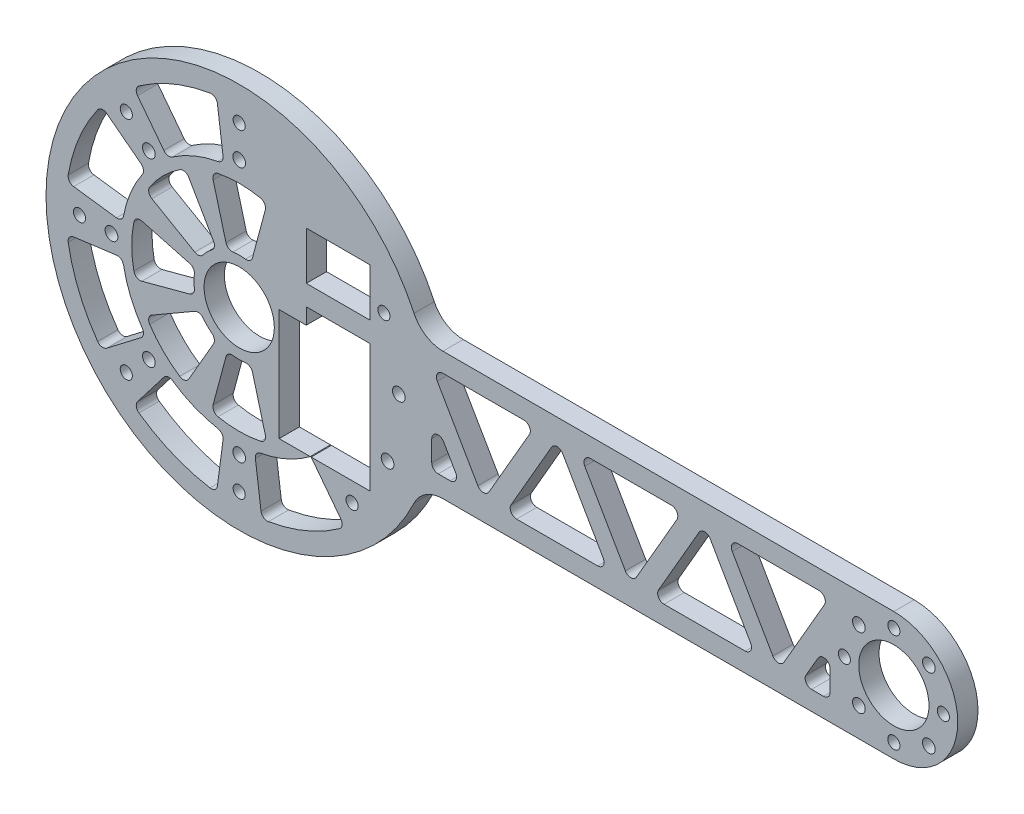
from build123d import *
from OCP.BRepFilletAPI import BRepFilletAPI_MakeChamfer

# Parameters (mm, degrees)
SKETCH1_R                = 11
SKETCH1_R_2              = 1.89865
SKETCH1_R_3              = 1.9939
BOSS_EXTRUDE1_DEPTH      = 6.35
FILLET1_R                = 10
CUT_EXTRUDE1_DEPTH       = 234.078468547
FILLET2_R                = 2
SKETCH3_W                = 20
SKETCH3_H                = 15
CUT_EXTRUDE2_DEPTH       = 234.078468547
CUT_EXTRUDE3_DEPTH       = 234.078468547
FILLET4_R                = 2
CIRPATTERN2_COUNT        = 8
FILLET4_OF_CIRPATTERN2_R = 2
CUT_EXTRUDE4_DEPTH       = 234.078468547
FILLET5_R                = 2
CIRPATTERN3_DEPTH        = 6.35
CHAMFER3_SIZE            = 2.301024407
CHAMFER3_SIZE2           = 2.00025


# Read off the part's stored shape, not the designer's step: CirPattern3
with BuildPart() as part:
    # Sketch1 → Boss-Extrude1 (new body)
    with BuildSketch(Plane.XY):
        with BuildLine():
            Line((57.098598932, -20), (205, -20))
            ThreePointArc((205, -20), (225, 0), (205, 20))
            Line((205, 20), (57.098598932, 20))
            ThreePointArc((57.098598932, 20), (-60.5, 0), (57.098598932, -20))
        make_face()
        Circle(SKETCH1_R, mode=Mode.SUBTRACT)
        with Locations((45.315389352, 21.130913087)):
            Circle(SKETCH1_R_2, mode=Mode.SUBTRACT)
        with Locations((46.467376211, -18.460307366)):
            Circle(SKETCH1_R_3, mode=Mode.SUBTRACT)
        with Locations((205, 0)):
            Circle(SKETCH1_R, mode=Mode.SUBTRACT)
        with Locations((49.978847504, 1.454235937)):
            Circle(SKETCH1_R_3, mode=Mode.SUBTRACT)
        with Locations((205, -15.5)):
            Circle(SKETCH1_R_2, mode=Mode.SUBTRACT)
        with Locations((215.960155108, -10.960155108)):
            Circle(SKETCH1_R_3, mode=Mode.SUBTRACT)
        with Locations((189.5, 0)):
            Circle(SKETCH1_R_2, mode=Mode.SUBTRACT)
        with Locations((194.039844892, -10.960155108)):
            Circle(SKETCH1_R_3, mode=Mode.SUBTRACT)
        with Locations((205, 15.5)):
            Circle(SKETCH1_R_2, mode=Mode.SUBTRACT)
        with Locations((194.039844892, 10.960155108)):
            Circle(SKETCH1_R_3, mode=Mode.SUBTRACT)
        with Locations((220.5, 0)):
            Circle(SKETCH1_R_2, mode=Mode.SUBTRACT)
        with Locations((215.960155108, 10.960155108)):
            Circle(SKETCH1_R_3, mode=Mode.SUBTRACT)
        with Locations((0, -40)):
            Circle(SKETCH1_R_3, mode=Mode.SUBTRACT)
        with Locations((0, -50)):
            Circle(SKETCH1_R_2, mode=Mode.SUBTRACT)
        with Locations((-28.284271247, -28.284271247)):
            Circle(SKETCH1_R_3, mode=Mode.SUBTRACT)
        with Locations((-35.355339059, -35.355339059)):
            Circle(SKETCH1_R_2, mode=Mode.SUBTRACT)
        with Locations((-40, 0)):
            Circle(SKETCH1_R_3, mode=Mode.SUBTRACT)
        with Locations((-50, 0)):
            Circle(SKETCH1_R_2, mode=Mode.SUBTRACT)
        with Locations((-28.284271247, 28.284271247)):
            Circle(SKETCH1_R_3, mode=Mode.SUBTRACT)
        with Locations((-35.355339059, 35.355339059)):
            Circle(SKETCH1_R_2, mode=Mode.SUBTRACT)
        with Locations((0, 40)):
            Circle(SKETCH1_R_3, mode=Mode.SUBTRACT)
        with Locations((0, 50)):
            Circle(SKETCH1_R_2, mode=Mode.SUBTRACT)
        with Locations((35.355339059, -35.355339059)):
            Circle(SKETCH1_R_2, mode=Mode.SUBTRACT)
    extrude(amount=BOSS_EXTRUDE1_DEPTH)

    # Fillet1
    fillet1_edges = [part.edges().sort_by_distance(p)[0] for p in [
        (57.098598932, 20, 3.175),
        (57.098598932, -20, 3.175),
    ]]
    fillet(fillet1_edges, radius=FILLET1_R)

    # Sketch2 → Cut-Extrude1 (cut, through all)
    with BuildSketch(Plane.XY.offset(6.35)):
        Polygon((60.292341855, 14), (92.62395693, 14), (76.458149392, -14), align=None)
        Polygon((83.386352623, -14), (99.55216016, 14), (115.717967697, -14), align=None)
        Polygon((106.48036339, 14), (122.646170928, -14), (138.811978465, 14), align=None)
        Polygon((129.574374158, -14), (145.740181695, 14), (161.905989232, -14), align=None)
        Polygon((152.668384925, 14), (168.834192463, -14), (185, 14), align=None)
        Polygon((60.292341855, 2), (60.292341855, -14), (69.529946162, -14), align=None)
        Polygon((185, 2), (185, -14), (175.762395693, -14), align=None)
    extrude(amount=-CUT_EXTRUDE1_DEPTH, mode=Mode.SUBTRACT)

    # Fillet2
    fillet2_edges = [part.edges().sort_by_distance(p)[0] for p in [
        (76.458149392, -14, 3.175),
        (60.292341855, 14, 3.175),
        (92.62395693, 14, 3.175),
        (115.717967697, -14, 3.175),
        (83.386352623, -14, 3.175),
        (99.55216016, 14, 3.175),
        (106.48036339, 14, 3.175),
        (138.811978465, 14, 3.175),
        (122.646170928, -14, 3.175),
        (161.905989232, -14, 3.175),
        (129.574374158, -14, 3.175),
        (145.740181695, 14, 3.175),
        (152.668384925, 14, 3.175),
        (185, 14, 3.175),
        (168.834192463, -14, 3.175),
        (60.292341855, 2, 3.175),
        (69.529946162, -14, 3.175),
        (60.292341855, -14, 3.175),
        (175.762395693, -14, 3.175),
        (185, 2, 3.175),
        (185, -14, 3.175),
    ]]
    fillet(fillet2_edges, radius=FILLET2_R)

    # Sketch3 → Cut-Extrude2 (cut, through all)
    with BuildSketch(Plane.XY):
        Polygon((12.5, -29.35), (41, -29.35), (41, 10.65), (21, 10.65), (21, 5.65), (12.5, 5.65), align=None)
        with Locations((31, 24.5)):
            Rectangle(SKETCH3_W, SKETCH3_H)
    extrude(amount=CUT_EXTRUDE2_DEPTH, mode=Mode.SUBTRACT)

    # Sketch4 → Cut-Extrude3 (cut, through all)
    with BuildSketch(Plane.XY.offset(6.35)):
        with BuildLine():
            Line((-13.691998588, 3.668759964), (-32.503404055, 8.709260868))
            ThreePointArc((-32.503404055, 8.709260868), (-33.65, 0), (-32.503404055, -8.709260868))
            Line((-32.503404055, -8.709260868), (-13.691998588, -3.668759964))
            ThreePointArc((-13.691998588, -3.668759964), (-14.175, 0), (-13.691998588, 3.668759964))
        make_face()
    cut_extrude3 = extrude(amount=-CUT_EXTRUDE3_DEPTH, mode=Mode.SUBTRACT)

    # Fillet4
    fillet4_edges = [part.edges().sort_by_distance(p)[0] for p in [
        (-13.691998588, 3.668759964, 3.175),
        (-13.691998588, -3.668759964, 3.175),
        (-32.503404055, -8.709260868, 3.175),
        (-32.503404055, 8.709260868, 3.175),
    ]]
    fillet(fillet4_edges, radius=FILLET4_R)

    # CirPattern2: Cut-Extrude3 ×8 about axis, 3 skipped
    cirpattern2_axis = Axis((0, 0, 0), (0, 0, -1))
    add([cut_extrude3.rotate(cirpattern2_axis, i * 360 / CIRPATTERN2_COUNT) for i in range(1, CIRPATTERN2_COUNT) if i not in (3, 4, 5)], mode=Mode.SUBTRACT)

    # Fillet4 of CirPattern2
    fillet4_of_cirpattern2_edges = [part.edges().sort_by_distance(p)[0] for p in [
        (-7.0875, 12.275910099, 3.175),
        (-12.275910099, 7.0875, 3.175),
        (-29.141754837, 16.825, 3.175),
        (-16.825, 29.141754837, 3.175),
        (3.668759964, 13.691998588, 3.175),
        (-3.668759964, 13.691998588, 3.175),
        (-8.709260868, 32.503404055, 3.175),
        (8.709260868, 32.503404055, 3.175),
        (-3.668759964, -13.691998588, 3.175),
        (3.668759964, -13.691998588, 3.175),
        (8.709260868, -32.503404055, 3.175),
        (-8.709260868, -32.503404055, 3.175),
        (-12.275910099, -7.0875, 3.175),
        (-7.0875, -12.275910099, 3.175),
        (-16.825, -29.141754837, 3.175),
        (-29.141754837, -16.825, 3.175),
    ]]
    fillet(fillet4_of_cirpattern2_edges, radius=FILLET4_OF_CIRPATTERN2_R)

    # Sketch5 → Cut-Extrude4 (cut, through all)
    with BuildSketch(Plane.XY.offset(6.35)):
        with BuildLine():
            Line((-43.098920211, 33.070964631), (-29.215236756, 22.417639623))
            ThreePointArc((-29.215236756, 22.417639623), (-34.021863785, 14.092317397), (-36.50995702, 4.806627029))
            Line((-36.50995702, 4.806627029), (-53.860242094, 7.090835392))
            ThreePointArc((-53.860242094, 7.090835392), (-50.189755604, 20.789277463), (-43.098920211, 33.070964631))
        make_face()
    extrude(amount=-CUT_EXTRUDE4_DEPTH, mode=Mode.SUBTRACT)

    # Fillet5
    fillet5_edges = [part.edges().sort_by_distance(p)[0] for p in [
        (-29.215236756, 22.417639623, 3.175),
        (-36.50995702, 4.806627029, 3.175),
        (-53.860242094, 7.090835392, 3.175),
        (-43.098920211, 33.070964631, 3.175),
    ]]
    fillet(fillet5_edges, radius=FILLET5_R)

    # CirPattern3 outline → CirPattern3 (cut)
    with BuildSketch(Plane.XY):
        with BuildLine():
            ThreePointArc((-20.882905689, 30.331252447), (-14.092317397, 34.021863785), (-6.680990063, 36.213878511))
            ThreePointArc((-6.680990063, 36.213878511), (-5.426291253, 37.004451007), (-5.060951125, 38.441740319))
            Line((-5.060951125, 38.441740319), (-6.824792128, 51.839442873))
            ThreePointArc((-6.824792128, 51.839442873), (-7.620711046, 53.188079996), (-9.144334764, 53.549853097))
            ThreePointArc((-9.144334764, 53.549853097), (-20.789277463, 50.189755604), (-31.399443135, 44.331485378))
            ThreePointArc((-31.399443135, 44.331485378), (-32.220995585, 42.998308501), (-31.830164795, 41.481878382))
            Line((-31.830164795, 41.481878382), (-23.6037824, 30.761048119))
            ThreePointArc((-23.6037824, 30.761048119), (-22.329130899, 30.003065582), (-20.882905689, 30.331252447))
        make_face()
        with BuildLine():
            ThreePointArc((22.240911065, -29.35), (14.862614113, -33.692481754), (6.680990063, -36.213878511))
            ThreePointArc((6.680990063, -36.213878511), (5.426291253, -37.004451007), (5.060951125, -38.441740319))
            Line((5.060951125, -38.441740319), (6.824792128, -51.839442873))
            ThreePointArc((6.824792128, -51.839442873), (7.620711046, -53.188079996), (9.144334764, -53.549853097))
            ThreePointArc((9.144334764, -53.549853097), (20.789277463, -50.189755604), (31.399443135, -44.331485378))
            ThreePointArc((31.399443135, -44.331485378), (32.220995585, -42.998308501), (31.830164795, -41.481878382))
            Line((31.830164795, -41.481878382), (22.521047097, -29.35))
            Line((22.521047097, -29.35), (22.240911065, -29.35))
        make_face()
        with BuildLine():
            ThreePointArc((-6.680990063, -36.213878511), (-14.092317397, -34.021863785), (-20.882905689, -30.331252447))
            ThreePointArc((-20.882905689, -30.331252447), (-22.329130899, -30.003065582), (-23.6037824, -30.761048119))
            Line((-23.6037824, -30.761048119), (-31.830164795, -41.481878382))
            ThreePointArc((-31.830164795, -41.481878382), (-32.220995585, -42.998308501), (-31.399443135, -44.331485378))
            ThreePointArc((-31.399443135, -44.331485378), (-20.789277463, -50.189755604), (-9.144334764, -53.549853097))
            ThreePointArc((-9.144334764, -53.549853097), (-7.620711046, -53.188079996), (-6.824792128, -51.839442873))
            Line((-6.824792128, -51.839442873), (-5.060951125, -38.441740319))
            ThreePointArc((-5.060951125, -38.441740319), (-5.426291253, -37.004451007), (-6.680990063, -36.213878511))
        make_face()
        with BuildLine():
            ThreePointArc((-30.331252447, -20.882905689), (-34.021863785, -14.092317397), (-36.213878511, -6.680990063))
            ThreePointArc((-36.213878511, -6.680990063), (-37.004451007, -5.426291253), (-38.441740319, -5.060951125))
            Line((-38.441740319, -5.060951125), (-51.839442873, -6.824792128))
            ThreePointArc((-51.839442873, -6.824792128), (-53.188079996, -7.620711046), (-53.549853097, -9.144334764))
            ThreePointArc((-53.549853097, -9.144334764), (-50.189755604, -20.789277463), (-44.331485378, -31.399443135))
            ThreePointArc((-44.331485378, -31.399443135), (-42.998308501, -32.220995585), (-41.481878382, -31.830164795))
            Line((-41.481878382, -31.830164795), (-30.761048119, -23.6037824))
            ThreePointArc((-30.761048119, -23.6037824), (-30.003065582, -22.329130899), (-30.331252447, -20.882905689))
        make_face()
    extrude(amount=CIRPATTERN3_DEPTH, mode=Mode.SUBTRACT)

    # Chamfer3: one chamfer whose edges measure the first distance from different faces: ONE call of the kernel's chamfer builder (chamfer() names one face for all edges)
    chamfer3_edges_1 = [part.edges().sort_by_distance(p)[0] for p in [
        (43.416739352, 21.130913087, 0),
    ]]
    chamfer3_side_1 = [part.faces().sort_by_distance(p)[0] for p in [
        (43.416739352, 21.130913087, 3.175),
    ]]
    chamfer3_edges_2 = [part.edges().sort_by_distance(p)[0] for p in [
        (-1.89865, -50, 0),
    ]]
    chamfer3_side_2 = [part.faces().sort_by_distance(p)[0] for p in [
        (-1.89865, -50, 3.175),
    ]]
    chamfer3_edges_3 = [part.edges().sort_by_distance(p)[0] for p in [
        (-37.253989059, -35.355339059, 0),
    ]]
    chamfer3_side_3 = [part.faces().sort_by_distance(p)[0] for p in [
        (-37.253989059, -35.355339059, 3.175),
    ]]
    chamfer3_edges_4 = [part.edges().sort_by_distance(p)[0] for p in [
        (-51.89865, 0, 0),
    ]]
    chamfer3_side_4 = [part.faces().sort_by_distance(p)[0] for p in [
        (-51.89865, 0, 3.175),
    ]]
    chamfer3_edges_5 = [part.edges().sort_by_distance(p)[0] for p in [
        (-37.253989059, 35.355339059, 0),
    ]]
    chamfer3_side_5 = [part.faces().sort_by_distance(p)[0] for p in [
        (-37.253989059, 35.355339059, 3.175),
    ]]
    chamfer3_edges_6 = [part.edges().sort_by_distance(p)[0] for p in [
        (-1.89865, 50, 0),
    ]]
    chamfer3_side_6 = [part.faces().sort_by_distance(p)[0] for p in [
        (-1.89865, 50, 3.175),
    ]]
    chamfer3_edges_7 = [part.edges().sort_by_distance(p)[0] for p in [
        (33.456689059, -35.355339059, 0),
    ]]
    chamfer3_side_7 = [part.faces().sort_by_distance(p)[0] for p in [
        (33.456689059, -35.355339059, 3.175),
    ]]
    chamfer3 = BRepFilletAPI_MakeChamfer(part.part.solid().wrapped)
    for e in chamfer3_edges_1:
        chamfer3.Add(CHAMFER3_SIZE, CHAMFER3_SIZE2, e.wrapped, chamfer3_side_1[0].wrapped)  # the first distance lies on this face
    for e in chamfer3_edges_2:
        chamfer3.Add(CHAMFER3_SIZE, CHAMFER3_SIZE2, e.wrapped, chamfer3_side_2[0].wrapped)  # the first distance lies on this face
    for e in chamfer3_edges_3:
        chamfer3.Add(CHAMFER3_SIZE, CHAMFER3_SIZE2, e.wrapped, chamfer3_side_3[0].wrapped)  # the first distance lies on this face
    for e in chamfer3_edges_4:
        chamfer3.Add(CHAMFER3_SIZE, CHAMFER3_SIZE2, e.wrapped, chamfer3_side_4[0].wrapped)  # the first distance lies on this face
    for e in chamfer3_edges_5:
        chamfer3.Add(CHAMFER3_SIZE, CHAMFER3_SIZE2, e.wrapped, chamfer3_side_5[0].wrapped)  # the first distance lies on this face
    for e in chamfer3_edges_6:
        chamfer3.Add(CHAMFER3_SIZE, CHAMFER3_SIZE2, e.wrapped, chamfer3_side_6[0].wrapped)  # the first distance lies on this face
    for e in chamfer3_edges_7:
        chamfer3.Add(CHAMFER3_SIZE, CHAMFER3_SIZE2, e.wrapped, chamfer3_side_7[0].wrapped)  # the first distance lies on this face
    add(Compound.cast(chamfer3.Shape()), mode=Mode.REPLACE)


solid = part.part
